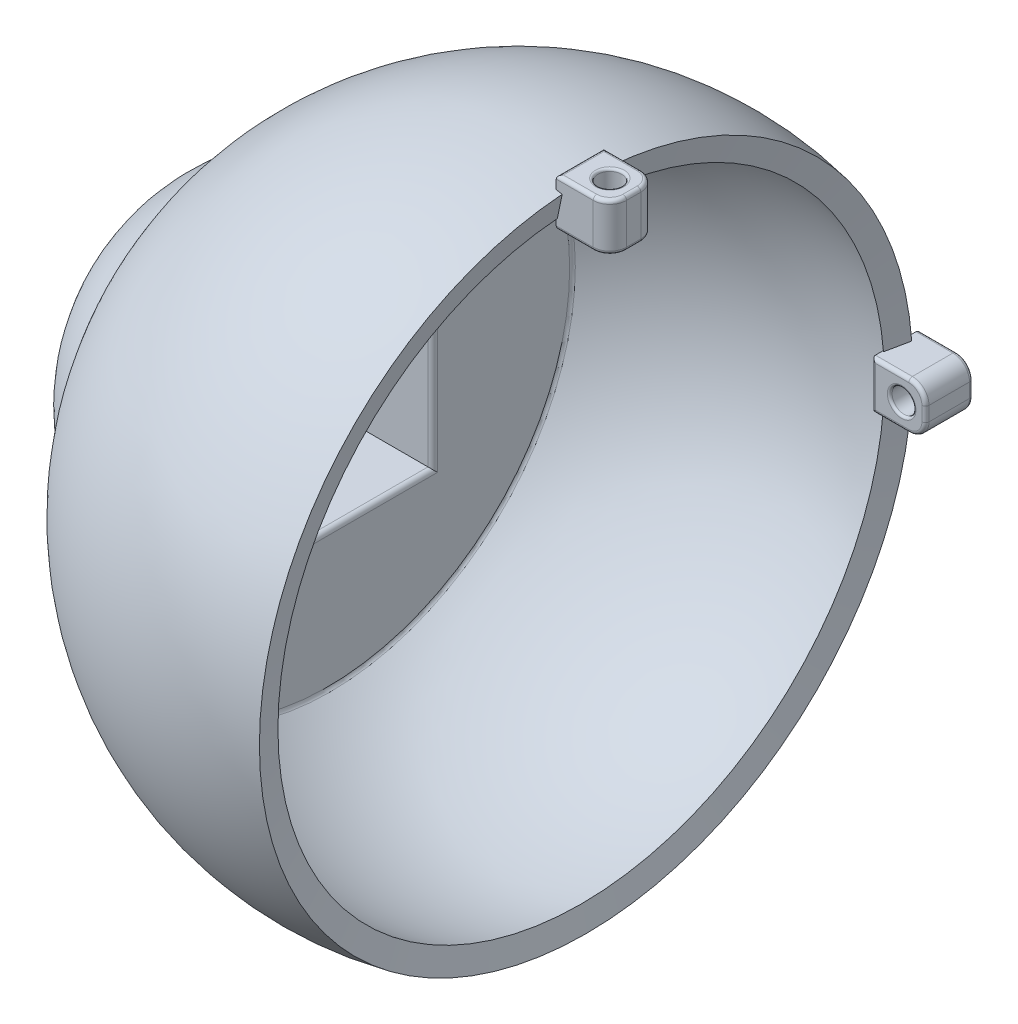
from build123d import *

# Parameters (mm, degrees)
SHELL3_T                        = -1
SKETCH3_R                       = 4.25
CUT_EXTRUDE2_DEPTH              = 71
EXTRUDE_THIN1_REACH             = 26.74
EXTRUDE_THIN1_END_RADIUS        = 7.082903769
SKETCH6_W                       = 9.8
SKETCH6_H                       = 9.911877538
SKETCH6_W_2                     = 8.8
SKETCH6_H_2                     = 8.911877538
EXTRUDE_THIN1_DIRECTION_2_DEPTH = 4
BOSS_EXTRUDE5_REACH             = 26.38
BOSS_EXTRUDE5_END_RADIUS        = 7.082903769
SKETCH8_W                       = 8.8
SKETCH8_H                       = 8.911877538
SKETCH8_R                       = 4.25
BOSS_EXTRUDE7_REACH             = 29.912
BOSS_EXTRUDE7_END_RADIUS        = 13
BOSS_EXTRUDE8_REACH             = 29.912
BOSS_EXTRUDE8_END_RADIUS        = 13
BOSS_EXTRUDE9_REACH             = 29.874
BOSS_EXTRUDE9_END_RADIUS        = 13
BOSS_EXTRUDE10_REACH            = 29.874
BOSS_EXTRUDE10_END_RADIUS       = 13
BOSS_EXTRUDE11_START            = 0.25
BOSS_EXTRUDE11_DEPTH            = 2
SKETCH17_R                      = 0.5
CUT_EXTRUDE3_DEPTH              = 2
FILLET1_R                       = 0.7
FILLET2_R                       = 0.15
FILLET9_R                       = 0.1
CIRPATTERN4_COUNT               = 2
CIRPATTERN4_ANGLE               = 90
FILLET6_R                       = 0.2
FILLET7_R                       = 0.2
FILLET8_R                       = 0.4


with BuildPart() as part:
    # Sketch2 → Revolve1 (revolve)
    with BuildSketch(Plane.XY):
        with BuildLine():
            Line((0, 0), (2.834192463, 13.710118639))
            ThreePointArc((2.834192463, 13.710118639), (-5.730026707, 12.773675819), (-12.124355653, 7))
            ThreePointArc((-12.124355653, 7), (-15.082903769, 4.041451884), (-16.165807537, 0))
            Line((-16.165807537, 0), (0, 0))
        make_face()
    revolve(axis=Axis((0, 0, 0), (-1, 0, 0)))

    # Shell3
    shell3_openings = [part.faces().sort_by_distance(p)[0] for p in [
        (1.417096231, -6.855059319, 0),
    ]]
    offset(amount=SHELL3_T, openings=shell3_openings, kind=Kind.INTERSECTION)

    # Sketch3 → Cut-Extrude2 (cut)
    with BuildSketch(Plane(origin=(0, 0, 0), x_dir=(0, 0, -1), z_dir=(1, 0, 0))):
        Circle(SKETCH3_R)
    extrude(amount=-CUT_EXTRUDE2_DEPTH, mode=Mode.SUBTRACT)

    # Extrude-Thin1: up to this sphere (the profile starts inside it)
    extrude_thin1_end = Location((-8.082903769, 0, 0)) * Sphere(EXTRUDE_THIN1_END_RADIUS, mode=Mode.PRIVATE)
    # Sketch6 → Extrude-Thin1 (add, up to the surface)
    with BuildSketch(Plane(origin=(-12, 0, 0), x_dir=(0, 0, -1), z_dir=(1, 0, 0)), mode=Mode.PRIVATE) as extrude_thin1_sk1:
        Rectangle(SKETCH6_W, SKETCH6_H)
        Rectangle(SKETCH6_W_2, SKETCH6_H_2, mode=Mode.SUBTRACT)
    extrude_thin1_tool1 = extrude(extrude_thin1_sk1.sketch, amount=-EXTRUDE_THIN1_REACH, mode=Mode.PRIVATE) & extrude_thin1_end
    add(extrude_thin1_tool1.solids().sort_by_distance((-12, -4.816553, 0))[0])
    add(extrude_thin1_tool1.solids().sort_by_distance((-12, -4.816553, 0))[1])
    add(extrude_thin1_tool1.solids().sort_by_distance((-12, -4.816553, 0))[2])
    add(extrude_thin1_tool1.solids().sort_by_distance((-12, -4.816553, 0))[3])

    # Sketch6 → Extrude-Thin1 direction 2 (add)
    with BuildSketch(Plane(origin=(-12, 0, 0), x_dir=(0, 0, -1), z_dir=(1, 0, 0))):
        Rectangle(SKETCH6_W, SKETCH6_H)
        Rectangle(SKETCH6_W_2, SKETCH6_H_2, mode=Mode.SUBTRACT)
    extrude(amount=EXTRUDE_THIN1_DIRECTION_2_DEPTH)

    # Boss-Extrude5: up to this sphere (the profile starts inside it)
    boss_extrude5_end = Location((-8.082903769, 0, 0)) * Sphere(BOSS_EXTRUDE5_END_RADIUS, mode=Mode.PRIVATE)
    # Sketch8 → Boss-Extrude5 (add, up to the surface)
    with BuildSketch(Plane(origin=(-11.392304845, 0, 0), x_dir=(0, 0, -1), z_dir=(1, 0, 0)), mode=Mode.PRIVATE) as boss_extrude5_sk1:
        Rectangle(SKETCH8_W, SKETCH8_H)
        Circle(SKETCH8_R, mode=Mode.SUBTRACT)
    boss_extrude5_tool1 = extrude(boss_extrude5_sk1.sketch, amount=-BOSS_EXTRUDE5_REACH, mode=Mode.PRIVATE) & boss_extrude5_end
    add(boss_extrude5_tool1.solids().sort_by_distance((-11.392305, 4.330694, 0))[0])

    # Boss-Extrude7: up to this sphere (the profile starts inside it)
    boss_extrude7_end = Location((0, 0, 0)) * Sphere(BOSS_EXTRUDE7_END_RADIUS, mode=Mode.PRIVATE)
    # Sketch12 → Boss-Extrude7 (add, up to the surface)
    with BuildSketch(Plane(origin=(0, 4.955938769, 0), x_dir=(1, 0, 0), z_dir=(0, 1, 0)), mode=Mode.PRIVATE) as boss_extrude7_sk1:
        with BuildLine():
            Line((-10.973999769, -4.9), (-8, -4.9))
            Line((-8, -4.9), (-8, 4.9))
            Line((-8, 4.9), (-10.973999769, 4.9))
            ThreePointArc((-10.973999769, 4.9), (-11.195988483, 4.369040262), (-11.392304845, 3.828062334))
            ThreePointArc((-11.392304845, 3.828062334), (-13.143160355, 0), (-11.392304845, -3.828062334))
            ThreePointArc((-11.392304845, -3.828062334), (-11.195988483, -4.369040262), (-10.973999769, -4.9))
        make_face()
    boss_extrude7_tool1 = extrude(boss_extrude7_sk1.sketch, amount=BOSS_EXTRUDE7_REACH, mode=Mode.PRIVATE) & boss_extrude7_end
    add(boss_extrude7_tool1.solids().sort_by_distance((-10.21205, 4.955939, 0))[0])

    # Boss-Extrude8: up to this sphere (the profile starts inside it)
    boss_extrude8_end = Location((0, 0, 0)) * Sphere(BOSS_EXTRUDE8_END_RADIUS, mode=Mode.PRIVATE)
    # Sketch13 → Boss-Extrude8 (add, up to the surface)
    with BuildSketch(Plane.XZ.offset(4.955938769), mode=Mode.PRIVATE) as boss_extrude8_sk1:
        with BuildLine():
            Line((-10.973999769, -4.9), (-8, -4.9))
            Line((-8, -4.9), (-8, 4.9))
            Line((-8, 4.9), (-10.973999769, 4.9))
            ThreePointArc((-10.973999769, 4.9), (-11.195988483, 4.369040262), (-11.392304845, 3.828062334))
            ThreePointArc((-11.392304845, 3.828062334), (-13.143160355, 0), (-11.392304845, -3.828062334))
            ThreePointArc((-11.392304845, -3.828062334), (-11.195988483, -4.369040262), (-10.973999769, -4.9))
        make_face()
    boss_extrude8_tool1 = extrude(boss_extrude8_sk1.sketch, amount=BOSS_EXTRUDE8_REACH, mode=Mode.PRIVATE) & boss_extrude8_end
    add(boss_extrude8_tool1.solids().sort_by_distance((-10.21205, -4.955939, 0))[0])

    # Boss-Extrude9: up to this sphere (the profile starts inside it)
    boss_extrude9_end = Location((0, 0, 0)) * Sphere(BOSS_EXTRUDE9_END_RADIUS, mode=Mode.PRIVATE)
    # Sketch14 → Boss-Extrude9 (add, up to the surface)
    with BuildSketch(Plane.XY.offset(4.9), mode=Mode.PRIVATE) as boss_extrude9_sk1:
        with BuildLine():
            Line((-8, -8.999444427), (-8, 8.999444427))
            ThreePointArc((-8, 8.999444427), (-10.025864662, 6.668735846), (-11.392304845, 3.899408969))
            ThreePointArc((-11.392304845, 3.899408969), (-13.197346631, 0), (-11.392304845, -3.899408969))
            ThreePointArc((-11.392304845, -3.899408969), (-10.025864662, -6.668735846), (-8, -8.999444427))
        make_face()
    boss_extrude9_tool1 = extrude(boss_extrude9_sk1.sketch, amount=BOSS_EXTRUDE9_REACH, mode=Mode.PRIVATE) & boss_extrude9_end
    add(boss_extrude9_tool1.solids().sort_by_distance((-9.949858, 0, 4.9))[0])

    # Boss-Extrude10: up to this sphere (the profile starts inside it)
    boss_extrude10_end = Location((0, 0, 0)) * Sphere(BOSS_EXTRUDE10_END_RADIUS, mode=Mode.PRIVATE)
    # Sketch15 → Boss-Extrude10 (add, up to the surface)
    with BuildSketch(Plane(origin=(0, 0, -4.9), x_dir=(-1, 0, 0), z_dir=(0, 0, -1)), mode=Mode.PRIVATE) as boss_extrude10_sk1:
        with BuildLine():
            Line((8, 8.999444427), (8, -8.999444427))
            ThreePointArc((8, -8.999444427), (10.025864662, -6.668735846), (11.392304845, -3.899408969))
            ThreePointArc((11.392304845, -3.899408969), (13.197346631, 0), (11.392304845, 3.899408969))
            ThreePointArc((11.392304845, 3.899408969), (10.025864662, 6.668735846), (8, 8.999444427))
        make_face()
    boss_extrude10_tool1 = extrude(boss_extrude10_sk1.sketch, amount=BOSS_EXTRUDE10_REACH, mode=Mode.PRIVATE) & boss_extrude10_end
    add(boss_extrude10_tool1.solids().sort_by_distance((-9.949858, 0, -4.9))[0])

    # Fillet6
    fillet6_edges = [part.edges().sort_by_distance(p)[0] for p in [
        (-8, 0, 4.4),
        (-8, -4.455938769, 0),
        (-8, 0, -4.4),
        (-8, 4.455938769, 0),
        (-8, -10.246950766, 0),
    ]]
    fillet(fillet6_edges, radius=FILLET6_R)

    # Fillet7
    fillet7_edges = [part.edges().sort_by_distance(p)[0] for p in [
        (-14.958282546, 3.00520382, -3.00520382),
        (-11.392304845, 0, 4.25),
    ]]
    fillet(fillet7_edges, radius=FILLET7_R)

    # Fillet8
    fillet8_edges = [part.edges().sort_by_distance(p)[0] for p in [
        (-12.124355653, -7, 0),
    ]]
    fillet(fillet8_edges, radius=FILLET8_R)


with BuildPart() as body_2:
    # Sketch16 → Boss-Extrude11 (new body)
    with BuildSketch(Plane(origin=(0, 0, -14), x_dir=(-1, 0, 0), z_dir=(0, 0, -1)).offset(BOSS_EXTRUDE11_START)):
        Polygon((-4.834192463, 1), (-2.834192463, 1), (-2.584192463, 1), (-2.584192463, -1), (-2.834192463, -1), (-4.834192463, -1), align=None)
    extrude(amount=-BOSS_EXTRUDE11_DEPTH)

    # Sketch17 → Cut-Extrude3 (cut)
    with BuildSketch(Plane(origin=(0, 13.25, -14.25), x_dir=(1, 0, 0), z_dir=(0, 0, 1))):
        with Locations((3.834192463, -13.25)):
            Circle(SKETCH17_R)
    extrude(amount=CUT_EXTRUDE3_DEPTH, mode=Mode.SUBTRACT)

    # Fillet1
    fillet1_edges = [body_2.edges().sort_by_distance(p)[0] for p in [
        (4.834192463, -1, -13.25),
        (4.834192463, 1, -13.25),
    ]]
    fillet(fillet1_edges, radius=FILLET1_R)

    # Fillet2
    fillet2_edges = [body_2.edges().sort_by_distance(p)[0] for p in [
        (3.359192463, 1, -14.25),
        (3.359192463, 1, -12.25),
        (3.359192463, -1, -12.25),
        (3.359192463, -1, -14.25),
        (2.584192463, 0, -12.25),
        (2.584192463, 0, -14.25),
        (4.62916721, -0.794974747, -14.25),
        (4.834192463, 0, -14.25),
        (4.62916721, 0.794974747, -14.25),
        (4.62916721, -0.794974747, -12.25),
        (4.834192463, 0, -12.25),
        (4.62916721, 0.794974747, -12.25),
    ]]
    fillet(fillet2_edges, radius=FILLET2_R)

    # Fillet9
    fillet9_edges = [body_2.edges().sort_by_distance(p)[0] for p in [
        (3.334192463, 0, -12.25),
        (3.334192463, 0, -14.25),
    ]]
    fillet(fillet9_edges, radius=FILLET9_R)


with BuildPart() as cirpattern4_1:
    # CirPattern4: pattern copy
    add(body_2.part.rotate(Axis((-17.248382677, 0, 0), (1, 0, 0)), 1 * CIRPATTERN4_ANGLE / (CIRPATTERN4_COUNT - 1)))


solid = Compound([part.part, body_2.part, cirpattern4_1.part])
